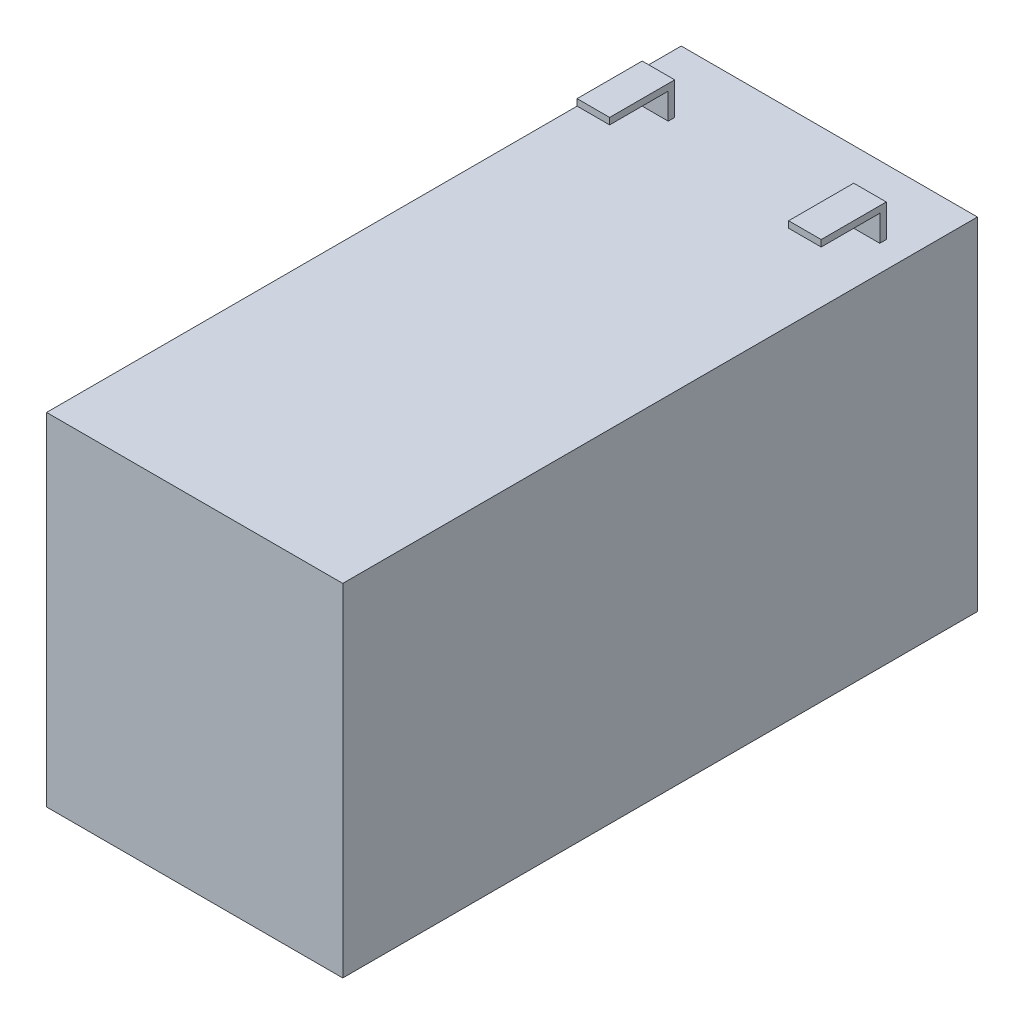
from build123d import *

# Parameters (mm, degrees)
SKETCH_1_W      = 45.5
SKETCH_1_H      = 97.5
EXTRUDE_1_DEPTH = 52.5
SKETCH_3_W      = 5
SKETCH_3_H      = 1


with BuildPart() as part:
    # 草图1 → 拉伸1 (new body)
    with BuildSketch(Plane(origin=(0, 0, 0), x_dir=(1, 0, 0), z_dir=(0, 1, 0))):
        with Locations((22.75, 48.75)):
            Rectangle(SKETCH_1_W, SKETCH_1_H)
    extrude(amount=EXTRUDE_1_DEPTH)

    # 扫描1: sweep along a path in 草图4
    with BuildLine(Plane.ZY.offset(-4)) as sweep_1_path:
        Line((-87.5, 52.5), (-87.5, 57.5))
        Line((-87.5, 57.5), (-77.5, 57.5))
    # 草图3 → 扫描1 (sweep)
    with BuildSketch(Plane(origin=(0, 52.5, 0), x_dir=(-1, 0, 0), z_dir=(0, 1, 0))):
        with Locations((-6.5, -87)):
            Rectangle(SKETCH_3_W, SKETCH_3_H)
    sweep_1 = sweep(path=sweep_1_path.line, transition=Transition.RIGHT)

    # 镜向2: 扫描1 across plane
    add(sweep_1.mirror(Plane.ZY.offset(-22.75)))


solid = part.part
